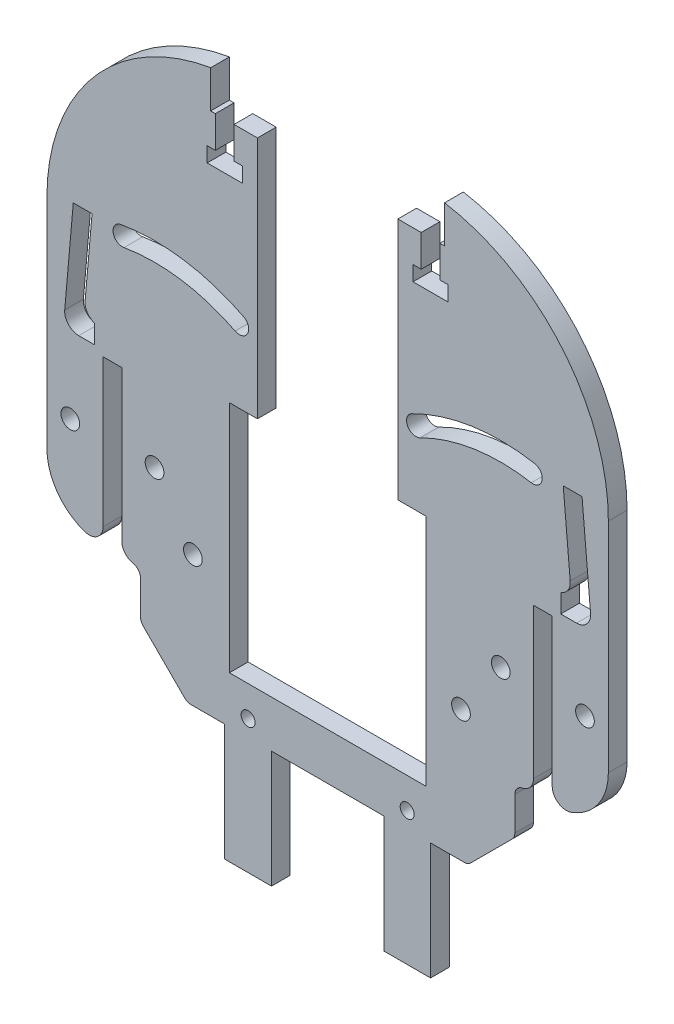
from build123d import *

# Parameters (mm, degrees)
BOSS_EXTRUDE1_DEPTH = 4
SKETCH2_R           = 2
SKETCH2_R_2         = 1.5
CUT_EXTRUDE1_DEPTH  = 95.026591983
SKETCH4_W           = 20
SKETCH4_H           = 100
BOSS_EXTRUDE2_DEPTH = 4
FILLET3_R           = 42
FILLET4_R           = 12
SKETCH7_R           = 2
CUT_EXTRUDE3_DEPTH  = 105.120122935
CHAMFER1_SIZE       = 10
FILLET8_R           = 2
CUT_EXTRUDE4_DEPTH  = 105.120122935
CUT_EXTRUDE5_DEPTH  = 105.120122935
SKETCH10_W          = 4
SKETCH10_H          = 35
CUT_EXTRUDE6_DEPTH  = 105.120122935
FILLET9_R           = 3


with BuildPart() as part:
    # Sketch1 → Boss-Extrude1 (new body)
    with BuildSketch(Plane.XY):
        Polygon((-40, 60), (-25, 60), (-25, 52), (-15, 52), (-15, 0), (-21, 0), (-21, -50), (21, -50), (21, 0), (15, 0), (15, 52), (25, 52), (25, 60), (40, 60), (40, -60), (22, -60), (22, -85), (12, -85), (12, -60), (-12, -60), (-12, -85), (-22, -85), (-22, -60), (-40, -60), align=None)
    extrude(amount=BOSS_EXTRUDE1_DEPTH)

    # Sketch2 → Cut-Extrude1 (cut, through all)
    with BuildSketch(Plane(origin=(0, 0, 0), x_dir=(-1, 0, 0), z_dir=(0, 0, -1))):
        with Locations((-28.5, -32)):
            Circle(SKETCH2_R)
        with Locations((17, -56.5)):
            Circle(SKETCH2_R_2)
        with Locations((28.8, -32)):
            Circle(SKETCH2_R)
        with Locations((-17, -56.5)):
            Circle(SKETCH2_R_2)
    extrude(amount=-CUT_EXTRUDE1_DEPTH, mode=Mode.SUBTRACT)

    # Sketch4 → Boss-Extrude2 (add)
    with BuildSketch(Plane.XY.offset(4)):
        with Locations((-50, 10)):
            Rectangle(SKETCH4_W, SKETCH4_H)
        with Locations((50, 10)):
            Rectangle(SKETCH4_W, SKETCH4_H)
    extrude(amount=-BOSS_EXTRUDE2_DEPTH)

    # Fillet3
    # the kernel refuses this fillet: 42 mm, written as the material it takes off along each edge
    with BuildSketch(Plane(origin=(60, 60, 107.531396204), x_dir=(0, -1, 0), z_dir=(0, 0, -1))) as fillet3_piece_1:
        with BuildLine():
            CenterArc((41.412558482, 42), FILLET3_R, 189.594068227, 80.405931773)
            Line((0, 35), (-0.82825117, 34.86))
            ThreePointArc((-0.82825117, 34.86), (-0.84, 17.5), (-0.84, 0))
            Line((-0.84, 0), (0, -0.84))
            Line((0, -0.84), (41.412558482, -0.84))
            Line((41.412558482, -0.84), (41.412558482, 0))
        make_face()
    extrude(amount=211.062792409, mode=Mode.SUBTRACT)
    with BuildSketch(Plane(origin=(-60, 60, 107.531396204), x_dir=(1, 0, 0), z_dir=(0, 0, -1))) as fillet3_piece_2:
        with BuildLine():
            CenterArc((42, 41.412558482), FILLET3_R, 180, 80.405931773)
            Line((0, 41.412558482), (-0.84, 41.412558482))
            Line((-0.84, 41.412558482), (-0.84, 0))
            Line((-0.84, 0), (0, -0.84))
            ThreePointArc((0, -0.84), (17.5, -0.84), (34.86, -0.82825117))
            Line((34.86, -0.82825117), (35, 0))
        make_face()
    extrude(amount=211.062792409, mode=Mode.SUBTRACT)

    # Fillet4
    fillet4_edges = [part.edges().sort_by_distance(p)[0] for p in [
        (60, -40, 2),
        (-60, -40, 2),
    ]]
    fillet(fillet4_edges, radius=FILLET4_R)

    # Sketch7 → Cut-Extrude3 (cut, through all)
    with BuildSketch(Plane.XY):
        with Locations(Location((-55, -20, 0), (0, 0, 180))):
            Circle(SKETCH7_R)
        with Locations(Location((55, -20, 0), (0, 0, 180))):
            Circle(SKETCH7_R)
        with Locations(Location((-37, -20, 0), (0, 0, 180))):
            Circle(SKETCH7_R)
        with Locations(Location((37, -20, 0), (0, 0, 180))):
            Circle(SKETCH7_R)
    extrude(amount=CUT_EXTRUDE3_DEPTH, mode=Mode.SUBTRACT)

    # Chamfer1
    chamfer1_edges = [part.edges().sort_by_distance(p)[0] for p in [
        (-40, -60, 2),
        (40, -60, 2),
    ]]
    chamfer(chamfer1_edges, length=CHAMFER1_SIZE)

    # Fillet8
    fillet8_edges = [part.edges().sort_by_distance(p)[0] for p in [
        (-30, -60, 2),
        (-40, -50, 2),
        (30, -60, 2),
        (40, -50, 2),
        (40, -40, 2),
        (-40, -40, 2),
    ]]
    fillet(fillet8_edges, radius=FILLET8_R)

    # Sketch8 → Cut-Extrude4 (cut, through all)
    with BuildSketch(Plane(origin=(0, 0, 0), x_dir=(-1, 0, 0), z_dir=(0, 0, -1))):
        with BuildLine():
            ThreePointArc((-17.964817996, 17.438774634), (-30.770630407, 21.535466224), (-44.214817996, 21.375674028))
            ThreePointArc((-44.214817996, 21.375674028), (-45.841525426, 19.061841075), (-43.527692473, 17.435133644))
            ThreePointArc((-43.527692473, 17.435133644), (-31.363903701, 17.579707536), (-19.777692473, 13.87317705))
            ThreePointArc((-19.777692473, 13.87317705), (-17.088456442, 14.749538603), (-17.964817996, 17.438774634))
        make_face()
        with BuildLine():
            ThreePointArc((17.964817996, 17.438774634), (30.770630407, 21.535466224), (44.214817996, 21.375674028))
            ThreePointArc((44.214817996, 21.375674028), (45.841525426, 19.061841075), (43.527692473, 17.435133644))
            ThreePointArc((43.527692473, 17.435133644), (31.363903701, 17.579707536), (19.777692473, 13.87317705))
            ThreePointArc((19.777692473, 13.87317705), (17.088456442, 14.749538603), (17.964817996, 17.438774634))
        make_face()
    extrude(amount=-CUT_EXTRUDE4_DEPTH, mode=Mode.SUBTRACT)

    # Sketch9 → Cut-Extrude5 (cut, through all)
    with BuildSketch(Plane.XY.offset(4)):
        Polygon((-24, 52), (-20, 52), (-20, 45.2), (-18.25, 45.2), (-18.25, 42), (-25.75, 42), (-25.75, 45.2), (-24, 45.2), align=None)
    cut_extrude5 = extrude(amount=-CUT_EXTRUDE5_DEPTH, mode=Mode.SUBTRACT)

    # Mirror1: Cut-Extrude5 across plane
    add(cut_extrude5.mirror(Plane(origin=(0, 0, 0), x_dir=(0, 0, 1), z_dir=(1, 0, 0))), mode=Mode.SUBTRACT)

    # Sketch10 → Cut-Extrude6 (cut, through all)
    with BuildSketch(Plane.XY.offset(4)):
        with Locations((46, -22.5)):
            Rectangle(SKETCH10_W, SKETCH10_H)
        Polygon((49.827462353, 0.296846572), (49.827462353, -3.703153428), (56.485281374, -3.703153428), (54.371414492, 20.296846572), (50.355929074, 20.296846572), (52.117484809, 0.296846572), align=None)
    cut_extrude6 = extrude(amount=-CUT_EXTRUDE6_DEPTH, mode=Mode.SUBTRACT)

    # Mirror2: Cut-Extrude6 across plane
    add(cut_extrude6.mirror(Plane(origin=(0, 0, 0), x_dir=(0, 0, 1), z_dir=(1, 0, 0))), mode=Mode.SUBTRACT)

    # Fillet9
    # the kernel refuses this fillet: 3 mm, written as the material it adds along each edge
    with BuildSketch(Plane(origin=(56.485281374, -3.703153428, 4), x_dir=(-1, 0, 0), z_dir=(0, 0, -1))) as fillet9_piece_1:
        with BuildLine():
            CenterArc((FILLET9_R * 1.09194914132, FILLET9_R), FILLET9_R, 174.966503844, 95.033496156)
            Line((FILLET9_R * 0.0958055662996, FILLET9_R * 1.08773812138), (0, 0))
            Line((0, 0), (FILLET9_R * 1.09194914132, 0))
        make_face()
    extrude(amount=4)
    with BuildSketch(Plane(origin=(-56.485281374, -3.703153428, 4), x_dir=(1, 0, 0), z_dir=(0, 0, -1))) as fillet9_piece_2:
        with BuildLine():
            CenterArc((FILLET9_R * 1.09194914132, -FILLET9_R), FILLET9_R, 90, 95.033496156)
            Line((FILLET9_R * 0.0958055662996, -FILLET9_R * 1.08773812138), (0, 0))
            Line((0, 0), (FILLET9_R * 1.09194914132, 0))
        make_face()
    extrude(amount=4)
    # the kernel refuses this fillet: 3 mm, written as the material it takes off along each edge
    with BuildSketch(Plane(origin=(52.117484809, 0.296846572, 11.783837895), x_dir=(-1, 0, 0), z_dir=(0, 0, -1))) as fillet9_2_piece_1:
        with BuildLine():
            CenterArc((3.261606451, 2.838313679), FILLET9_R, 174.966503844, 76.136892771)
            Line((0.273175726, 3.101528043), (0, 0))
            Line((0, 0), (2.290022456, 0))
        make_face()
    extrude(amount=19.56767579, mode=Mode.SUBTRACT)
    with BuildSketch(Plane(origin=(48, -40, 14.146118724), x_dir=(0, 1, 0), z_dir=(0, 0, -1))) as fillet9_2_piece_2:
        with BuildLine():
            CenterArc((3.514718626, 3), FILLET9_R, 160.528779366, 109.471220634)
            ThreePointArc((0.686291501, 4), (0.172817284, 2.029223745), (0, 0))
            Line((0, 0), (3.514718626, 0))
        make_face()
    extrude(amount=24.292237447, mode=Mode.SUBTRACT)
    with BuildSketch(Plane(origin=(44, -40, 11.247448714), x_dir=(-0.9998582920116396, -0.01683436650328442, 0), z_dir=(0, 0, -1))) as fillet9_2_piece_3:
        with BuildLine():
            CenterArc((2.950772393, 2.949071777), FILLET9_R, 180.964583715, 78.463040967)
            Line((-0.048802483, 2.898568677), (-0.348759971, 2.893518367))
            Line((-0.348759971, 2.893518367), (-0.299957488, -0.00505031))
            Line((-0.299957488, -0.00505031), (0.00505031, -0.299957488))
            ThreePointArc((0.00505031, -0.299957488), (2.004766894, -0.266288755), (2.345296923, -0.294907178))
            Line((2.345296923, -0.294907178), (2.400340147, 0))
        make_face()
    extrude(amount=18.494897428, mode=Mode.SUBTRACT)
    with BuildSketch(Plane(origin=(-44, -40, 11.247448714), x_dir=(0, 1, 0), z_dir=(0, 0, -1))) as fillet9_2_piece_4:
        with BuildLine():
            CenterArc((2.898979486, 3), FILLET9_R, 191.536959033, 78.463040967)
            Line((-0.040408206, 2.4), (-0.334346975, 2.34))
            ThreePointArc((-0.334346975, 2.34), (-0.3, 2), (-0.3, 0))
            Line((-0.3, 0), (0, -0.3))
            Line((0, -0.3), (2.898979486, -0.3))
            Line((2.898979486, -0.3), (2.898979486, 0))
        make_face()
    extrude(amount=18.494897428, mode=Mode.SUBTRACT)
    with BuildSketch(Plane(origin=(-48, -40, 14.146118724), x_dir=(-0.9855985596534866, 0.16910197872577487, 0), z_dir=(0, 0, -1))) as fillet9_2_piece_5:
        with BuildLine():
            CenterArc((3.551141553, 2.956795679), FILLET9_R, 170.264389683, 109.471220634)
            Line((0.594345874, 3.464101615), (0, 0))
            ThreePointArc((0, 0), (2.029223745, -0.172817284), (4.058447489, 0))
        make_face()
    extrude(amount=24.292237447, mode=Mode.SUBTRACT)
    with BuildSketch(Plane(origin=(-52.117484809, 0.296846572, 11.783837895), x_dir=(0.08773812137778342, 0.9961435750217422, 0), z_dir=(0, 0, -1))) as fillet9_2_piece_6:
        with BuildLine():
            CenterArc((3.113535158, 3), FILLET9_R, 193.863107229, 76.136892771)
            Line((0.200922268, 2.281191156), (0, 0))
            Line((0, 0), (3.113535158, 0))
        make_face()
    extrude(amount=19.56767579, mode=Mode.SUBTRACT)


solid = part.part
